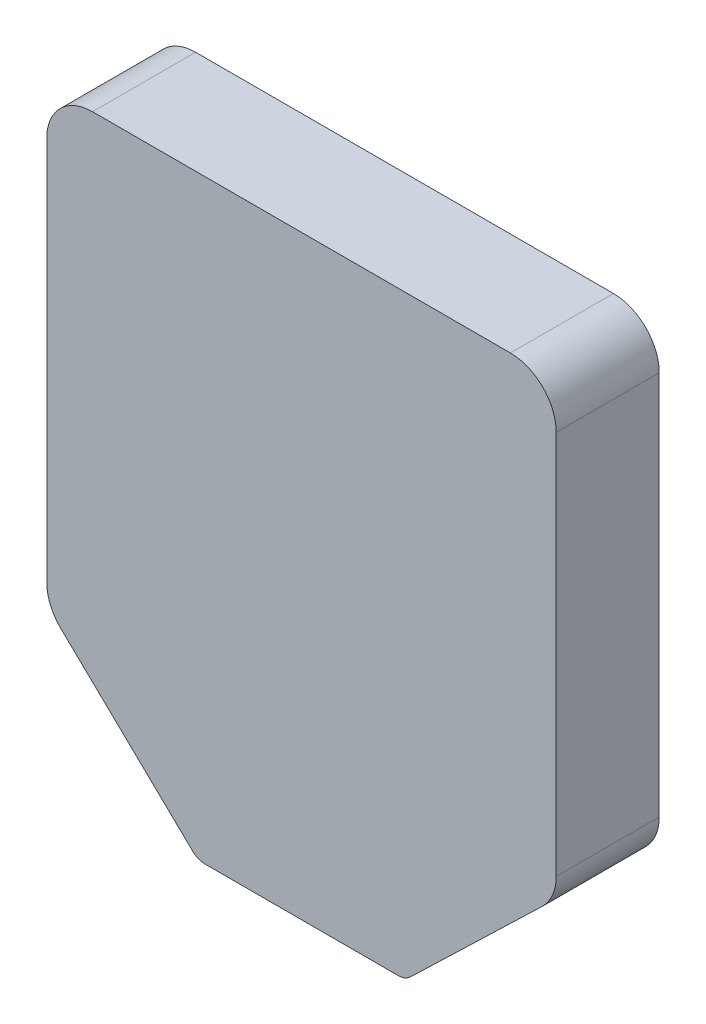
from build123d import *

# Parameters (mm, degrees)
PALM_BODY_DEPTH = 9


with BuildPart() as part:
    # Palm_sketch → Palm_Body (new, symmetric)
    with BuildSketch(Plane.XY):
        with BuildLine():
            Line((-36.5, 78.60257579), (36.5, 78.60257579))
            ThreePointArc((36.5, 78.60257579), (42.156854249, 76.259430039), (44.5, 70.60257579))
            Line((44.5, 70.60257579), (44.5, 3.401763707))
            ThreePointArc((44.5, 3.401763707), (43.86206295, 0.271263888), (42.04999272, -2.359970476))
            Line((42.04999272, -2.359970476), (19.004994037, -24.558074529))
            ThreePointArc((19.004994037, -24.558074529), (18.045809386, -25.179685068), (16.923746767, -25.39742421))
            Line((16.923746767, -25.39742421), (-16.891594266, -25.39742421))
            ThreePointArc((-16.891594266, -25.39742421), (-18.012780844, -25.180038208), (-18.971480575, -24.55938465))
            Line((-18.971480575, -24.55938465), (-42.04636349, -2.360489531))
            ThreePointArc((-42.04636349, -2.360489531), (-43.861076957, 0.27192072), (-44.5, 3.404738308))
            Line((-44.5, 3.404738308), (-44.5, 70.60257579))
            ThreePointArc((-44.5, 70.60257579), (-42.156854249, 76.259430039), (-36.5, 78.60257579))
        make_face()
    extrude(amount=PALM_BODY_DEPTH, both=True)


solid = part.part
